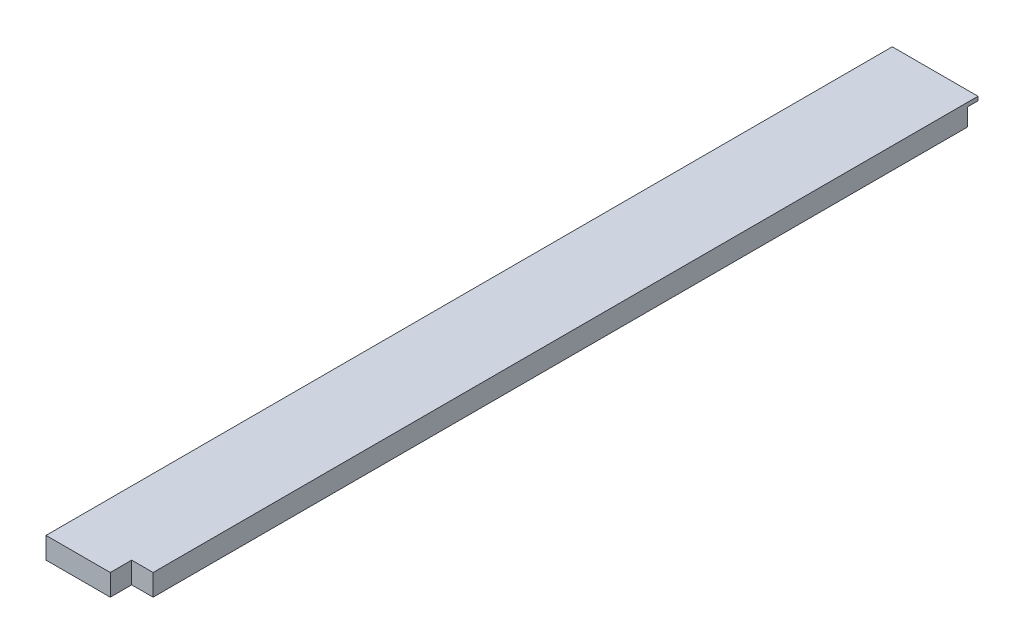
from build123d import *

# Parameters (mm, degrees)
BOSS_EXTRUDE1_DEPTH = 501.65
SKETCH3_W           = 50.8
SKETCH3_H           = 6.35
CUT_EXTRUDE1_DEPTH  = 10.3378
SKETCH4_W           = 12.7
SKETCH4_H           = 12.7
CUT_EXTRUDE4_DEPTH  = 505.375507435


with BuildPart() as part:
    # Sketch1 → Boss-Extrude1 (new body)
    with BuildSketch(Plane.XY):
        Polygon((0, 12.7), (38.1, 12.7), (50.8, 12.7), (50.8, 6.35), (50.8, 0), (0, 0), align=None)
    extrude(amount=BOSS_EXTRUDE1_DEPTH)

    # Sketch3 → Cut-Extrude1 (cut)
    with BuildSketch(Plane(origin=(0, 0, 0), x_dir=(1, 0, 0), z_dir=(0, 1, 0))):
        with Locations((25.4, -3.175)):
            Rectangle(SKETCH3_W, SKETCH3_H)
    extrude(amount=CUT_EXTRUDE1_DEPTH, mode=Mode.SUBTRACT)

    # Sketch4 → Cut-Extrude4 (cut, through all)
    with BuildSketch(Plane.XZ):
        with Locations((44.45, 495.3)):
            Rectangle(SKETCH4_W, SKETCH4_H)
    extrude(amount=-CUT_EXTRUDE4_DEPTH, mode=Mode.SUBTRACT)


solid = part.part
